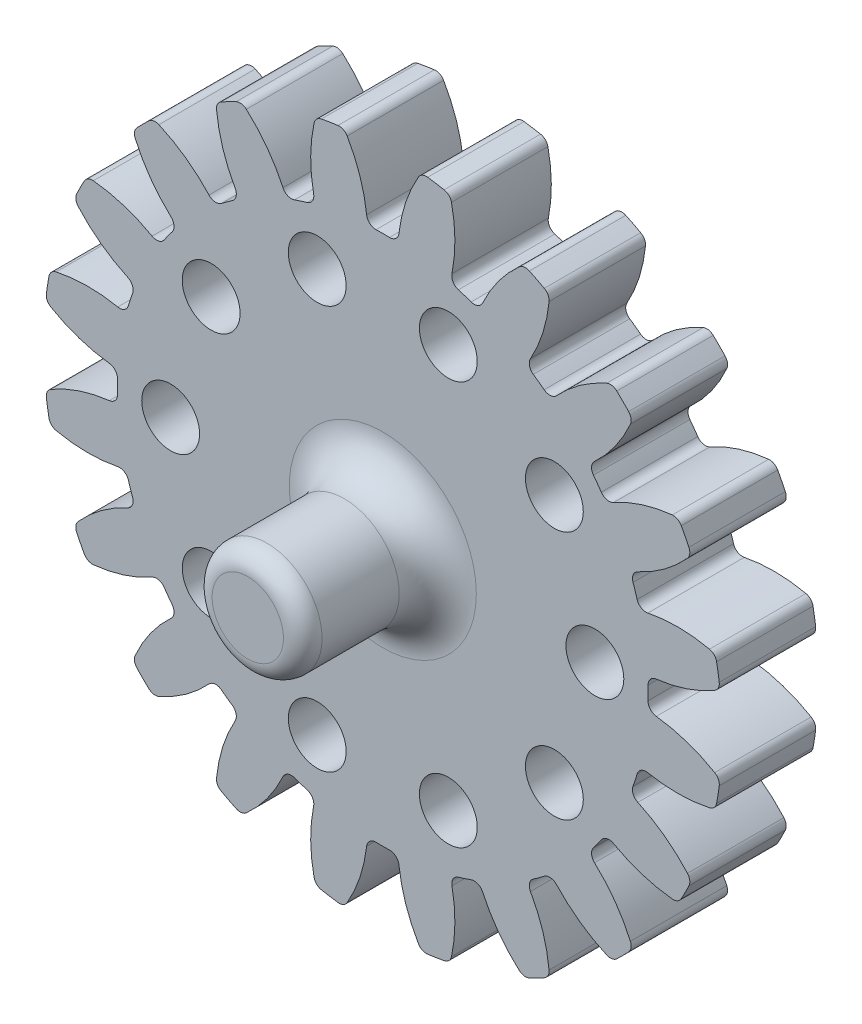
from build123d import *

# Parameters (mm, degrees)
SKETCH1_R                = 17.6
BOSS_EXTRUDE1_DEPTH      = 2.5
CUT_EXTRUDE1_DEPTH       = 26.387398449
FILLET1_R                = 0.48
CIRPATTERN1_COUNT        = 20
FILLET1_OF_CIRPATTERN1_R = 0.48
SKETCH23_R               = 3.25
CUT_EXTRUDE9_DEPTH       = 0.7
SKETCH24_R               = 4
CUT_EXTRUDE10_DEPTH      = 10
SKETCH25_R               = 4.603821227
BOSS_EXTRUDE2_DEPTH      = 5
SKETCH26_R               = 2.85
BOSS_EXTRUDE3_DEPTH      = 7
BOSS_EXTRUDE4_START      = 7
SKETCH27_R               = 2.85
BOSS_EXTRUDE4_DEPTH      = 7
FILLET2_R                = 2
FILLET3_R                = 1
CUT_EXTRUDE11_START      = -5
CUT_EXTRUDE11_OUTLINE_R  = 1.5
CUT_EXTRUDE11_DEPTH      = 5


# Read off the part's stored shape, not the designer's step: Cut-Extrude11
with BuildPart() as part:
    # Sketch1 → Boss-Extrude1 (new, symmetric)
    with BuildSketch(Plane.XY):
        Circle(SKETCH1_R)
    extrude(amount=BOSS_EXTRUDE1_DEPTH, both=True)

    # Sketch3 → Cut-Extrude1 (cut, symmetric)
    with BuildSketch(Plane.XY.offset(2.5)):
        with BuildLine():
            ThreePointArc((-2.700950464, 18.402849415), (-1.362234672, 16.227807184), (-0.798364242, 13.736819666))
            ThreePointArc((-0.798364242, 13.736819666), (0, 13.76), (0.798364242, 13.736819666))
            ThreePointArc((0.798364242, 13.736819666), (1.362234672, 16.227807184), (2.700950464, 18.402849415))
            ThreePointArc((2.700950464, 18.402849415), (0, 18.6), (-2.700950464, 18.402849415))
        make_face()
    cut_extrude1 = extrude(amount=CUT_EXTRUDE1_DEPTH, both=True, mode=Mode.SUBTRACT)

    # Fillet1
    fillet1_edges = [part.edges().sort_by_distance(p)[0] for p in [
        (-2.013394308, 17.484457194, 0),
        (-0.798364242, 13.736819666, 0),
        (0.798364242, 13.736819666, 0),
        (2.013394308, 17.484457194, 0),
    ]]
    fillet(fillet1_edges, radius=FILLET1_R)

    # CirPattern1: Cut-Extrude1 ×20 about axis
    cirpattern1_axis = Axis((0, 0, 0), (0, 0, 1))
    for i in range(1, CIRPATTERN1_COUNT):
        add(cut_extrude1.rotate(cirpattern1_axis, i * 360 / CIRPATTERN1_COUNT), mode=Mode.SUBTRACT)

    # Fillet1 of CirPattern1
    fillet1_of_cirpattern1_edges = [part.edges().sort_by_distance(p)[0] for p in [
        (-7.317846187, 16.00653389, 0),
        (-5.004200241, 12.817783738, 0),
        (-3.48562121, 13.311199975, 0),
        (-3.488142633, 17.250880006, 0),
        (-11.905976295, 12.961779526, 0),
        (-8.720190253, 10.644053831, 0),
        (-7.428409773, 11.582587286, 0),
        (-8.648235871, 15.328666489, 0),
        (-15.328666489, 8.648235871, 0),
        (-11.582587286, 7.428409773, 0),
        (-10.644053831, 8.720190253, 0),
        (-12.961779526, 11.905976295, 0),
        (-17.250880006, 3.488142633, 0),
        (-13.311199975, 3.48562121, 0),
        (-12.817783738, 5.004200241, 0),
        (-16.00653389, 7.317846187, 0),
        (-17.484457194, -2.013394308, 0),
        (-13.736819666, -0.798364242, 0),
        (-13.736819666, 0.798364242, 0),
        (-17.484457194, 2.013394308, 0),
        (-16.00653389, -7.317846187, 0),
        (-12.817783738, -5.004200241, 0),
        (-13.311199975, -3.48562121, 0),
        (-17.250880006, -3.488142633, 0),
        (-12.961779526, -11.905976295, 0),
        (-10.644053831, -8.720190253, 0),
        (-11.582587286, -7.428409773, 0),
        (-15.328666489, -8.648235871, 0),
        (-8.648235871, -15.328666489, 0),
        (-7.428409773, -11.582587286, 0),
        (-8.720190253, -10.644053831, 0),
        (-11.905976295, -12.961779526, 0),
        (-3.488142633, -17.250880006, 0),
        (-3.48562121, -13.311199975, 0),
        (-5.004200241, -12.817783738, 0),
        (-7.317846187, -16.00653389, 0),
        (2.013394308, -17.484457194, 0),
        (0.798364242, -13.736819666, 0),
        (-0.798364242, -13.736819666, 0),
        (-2.013394308, -17.484457194, 0),
        (7.317846187, -16.00653389, 0),
        (5.004200241, -12.817783738, 0),
        (3.48562121, -13.311199975, 0),
        (3.488142633, -17.250880006, 0),
        (11.905976295, -12.961779526, 0),
        (8.720190253, -10.644053831, 0),
        (7.428409773, -11.582587286, 0),
        (8.648235871, -15.328666489, 0),
        (15.328666489, -8.648235871, 0),
        (11.582587286, -7.428409773, 0),
        (10.644053831, -8.720190253, 0),
        (12.961779526, -11.905976295, 0),
        (17.250880006, -3.488142633, 0),
        (13.311199975, -3.48562121, 0),
        (12.817783738, -5.004200241, 0),
        (16.00653389, -7.317846187, 0),
        (17.484457194, 2.013394308, 0),
        (13.736819666, 0.798364242, 0),
        (13.736819666, -0.798364242, 0),
        (17.484457194, -2.013394308, 0),
        (16.00653389, 7.317846187, 0),
        (12.817783738, 5.004200241, 0),
        (13.311199975, 3.48562121, 0),
        (17.250880006, 3.488142633, 0),
        (12.961779526, 11.905976295, 0),
        (10.644053831, 8.720190253, 0),
        (11.582587286, 7.428409773, 0),
        (15.328666489, 8.648235871, 0),
        (8.648235871, 15.328666489, 0),
        (7.428409773, 11.582587286, 0),
        (8.720190253, 10.644053831, 0),
        (11.905976295, 12.961779526, 0),
        (3.488142633, 17.250880006, 0),
        (3.48562121, 13.311199975, 0),
        (5.004200241, 12.817783738, 0),
        (7.317846187, 16.00653389, 0),
    ]]
    fillet(fillet1_of_cirpattern1_edges, radius=FILLET1_OF_CIRPATTERN1_R)

    # Sketch23 → Cut-Extrude9 (cut)
    with BuildSketch(Plane(origin=(0, 0, -2.5), x_dir=(-1, 0, 0), z_dir=(0, 0, -1))):
        Circle(SKETCH23_R)
    extrude(amount=-CUT_EXTRUDE9_DEPTH, mode=Mode.SUBTRACT)

    # Sketch24 → Cut-Extrude10 (cut)
    with BuildSketch(Plane.XY.offset(2.5)):
        Circle(SKETCH24_R)
    extrude(amount=-CUT_EXTRUDE10_DEPTH, mode=Mode.SUBTRACT)

    # Sketch25 → Boss-Extrude2 (add, through all)
    with BuildSketch(Plane.XY.offset(2.5)):
        Circle(SKETCH25_R)
    extrude(amount=-BOSS_EXTRUDE2_DEPTH)

    # Sketch26 → Boss-Extrude3 (add)
    with BuildSketch(Plane(origin=(0, 0, -2.5), x_dir=(-1, 0, 0), z_dir=(0, 0, -1))):
        with Locations(Location((0, 0, 0), (0, 0, 180))):
            Circle(SKETCH26_R)
    extrude(amount=BOSS_EXTRUDE3_DEPTH)

    # Sketch27 → Boss-Extrude4 (add)
    with BuildSketch(Plane.XY.offset(2.5).offset(BOSS_EXTRUDE4_START)):
        Circle(SKETCH27_R)
    extrude(amount=-BOSS_EXTRUDE4_DEPTH)

    # Fillet2
    fillet2_edges = [part.edges().sort_by_distance(p)[0] for p in [
        (-2.85, 0, -2.5),
        (-2.85, 0, 2.5),
    ]]
    fillet(fillet2_edges, radius=FILLET2_R)

    # Fillet3
    fillet3_edges = [part.edges().sort_by_distance(p)[0] for p in [
        (-2.85, 0, -9.5),
        (-2.85, 0, 9.5),
    ]]
    fillet(fillet3_edges, radius=FILLET3_R)

    # Cut-Extrude11 outline → Cut-Extrude11 (cut)
    with BuildSketch(Plane(origin=(0, 0, -2.5), x_dir=(-1, 0, 0), z_dir=(0, 0, -1)).offset(CUT_EXTRUDE11_START)):
        with Locations((-8.897377921, -6.46504999)):
            Circle(CUT_EXTRUDE11_OUTLINE_R)
        with Locations((8.899377921, -6.46504999)):
            Circle(CUT_EXTRUDE11_OUTLINE_R)
        with Locations((-10.998, 0)):
            Circle(CUT_EXTRUDE11_OUTLINE_R)
        with Locations((-8.897377921, 6.46504999)):
            Circle(CUT_EXTRUDE11_OUTLINE_R)
        with Locations((-3.397877921, 10.460670623)):
            Circle(CUT_EXTRUDE11_OUTLINE_R)
        with Locations((3.399877921, 10.460670623)):
            Circle(CUT_EXTRUDE11_OUTLINE_R)
        with Locations((8.899377921, 6.46504999)):
            Circle(CUT_EXTRUDE11_OUTLINE_R)
        with Locations((11, 0)):
            Circle(CUT_EXTRUDE11_OUTLINE_R)
        with Locations((3.399877921, -10.460670623)):
            Circle(CUT_EXTRUDE11_OUTLINE_R)
        with Locations((-3.397877921, -10.460670623)):
            Circle(CUT_EXTRUDE11_OUTLINE_R)
    extrude(amount=CUT_EXTRUDE11_DEPTH, mode=Mode.SUBTRACT)


solid = part.part
